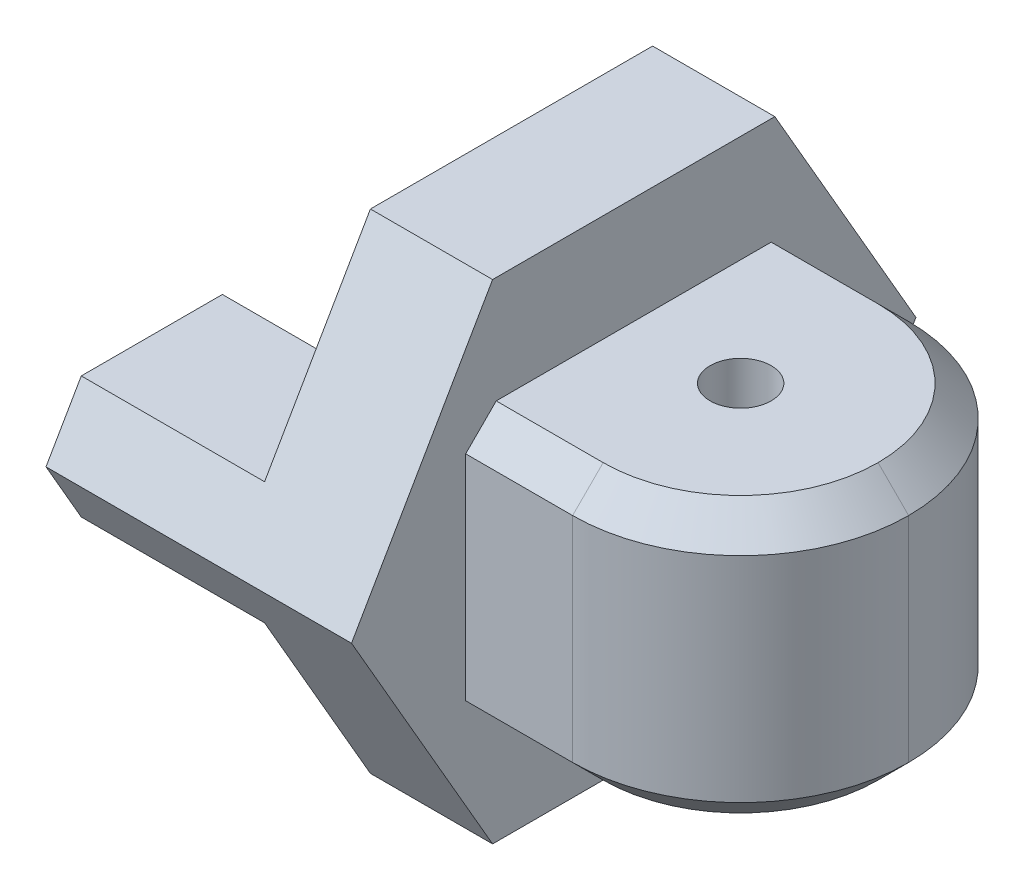
from build123d import *

# Parameters (mm, degrees)
SKETCH_2_R          = 20
EXTRUDE_1_DEPTH     = 50
CUT_EXTRUDE_2_DEPTH = 30
CUT_EXTRUDE_3_DEPTH = 30
SKETCH_5_W          = 55
SKETCH_5_H          = 45
EXTRUDE_2_DEPTH     = 45
FILLET_2_R          = 27.5
FILLET_3_R          = 27.5
CHAMFER_1_SIZE      = 5
SKETCH_6_R          = 5
CUT_EXTRUDE_4_DEPTH = 123.737864302
CHAMFER_2_SIZE      = 5


with BuildPart() as part:
    # 스케치2 → 보스-돌출1 (new body)
    with BuildSketch(Plane(origin=(0, 0, 0), x_dir=(0, 0, -1), z_dir=(1, 0, 0))):
        Polygon((46.188021535, 0), (23.094010768, 40), (-23.094010768, 40), (-46.188021535, 0), (-23.094010768, -40), (23.094010768, -40), align=None)
        Circle(SKETCH_2_R, mode=Mode.SUBTRACT)
    extrude(amount=EXTRUDE_1_DEPTH)

    # 스케치3 → 컷-돌출2 (cut)
    with BuildSketch(Plane.ZY):
        with BuildLine():
            ThreePointArc((-17.320508076, 10), (0, 20), (17.320508076, 10))
            Line((17.320508076, 10), (40.414518843, 10))
            Line((40.414518843, 10), (23.094010768, 40))
            Line((23.094010768, 40), (-23.094010768, 40))
            Line((-23.094010768, 40), (-40.414518843, 10))
            Line((-40.414518843, 10), (-17.320508076, 10))
        make_face()
    extrude(amount=-CUT_EXTRUDE_2_DEPTH, mode=Mode.SUBTRACT)

    # 스케치3<4> → 컷-돌출3 (cut)
    with BuildSketch(Plane.ZY):
        with BuildLine():
            Line((40.414518843, -10), (17.320508076, -10))
            ThreePointArc((17.320508076, -10), (0, -20), (-17.320508076, -10))
            Line((-17.320508076, -10), (-40.414518843, -10))
            Line((-40.414518843, -10), (-23.094010768, -40))
            Line((-23.094010768, -40), (23.094010768, -40))
            Line((23.094010768, -40), (40.414518843, -10))
        make_face()
    extrude(amount=-CUT_EXTRUDE_3_DEPTH, mode=Mode.SUBTRACT)

    # 스케치5 → 보스-돌출2 (add)
    with BuildSketch(Plane(origin=(50, 0, 0), x_dir=(0, 0, -1), z_dir=(1, 0, 0))):
        Rectangle(SKETCH_5_W, SKETCH_5_H)
    extrude(amount=EXTRUDE_2_DEPTH)

    # 필렛2
    fillet_2_edges = [part.edges().sort_by_distance(p)[0] for p in [
        (95, 0, -27.5),
    ]]
    fillet(fillet_2_edges, radius=FILLET_2_R)

    # 필렛3
    fillet_3_edges = [part.edges().sort_by_distance(p)[0] for p in [
        (95, 0, 27.5),
    ]]
    fillet(fillet_3_edges, radius=FILLET_3_R - 0.0001)  # a hair under: the kernel refuses the full size

    # 모따기1
    chamfer_1_edges = [part.edges().sort_by_distance(p)[0] for p in [
        (58.75, -22.5, -27.5),
        (86.945436483, -22.5, -19.445436483),
        (58.75005, -22.5, 27.5),
        (86.945465772, -22.5, 19.445465772),
    ]]
    chamfer(chamfer_1_edges, length=CHAMFER_1_SIZE)

    # 스케치6 → 컷-돌출4 (cut, through all)
    with BuildSketch(Plane.XZ.offset(22.5)):
        with Locations(Location((67.5, 0, 0), (0, 0, 270))):
            Circle(SKETCH_6_R)
    extrude(amount=-CUT_EXTRUDE_4_DEPTH, mode=Mode.SUBTRACT)

    # 모따기2
    chamfer_2_edges = [part.edges().sort_by_distance(p)[0] for p in [
        (58.75, 22.5, -27.5),
        (86.945436483, 22.5, -19.445436483),
        (58.75005, 22.5, 27.5),
        (86.945465772, 22.5, 19.445465772),
    ]]
    chamfer(chamfer_2_edges, length=CHAMFER_2_SIZE)


solid = part.part
